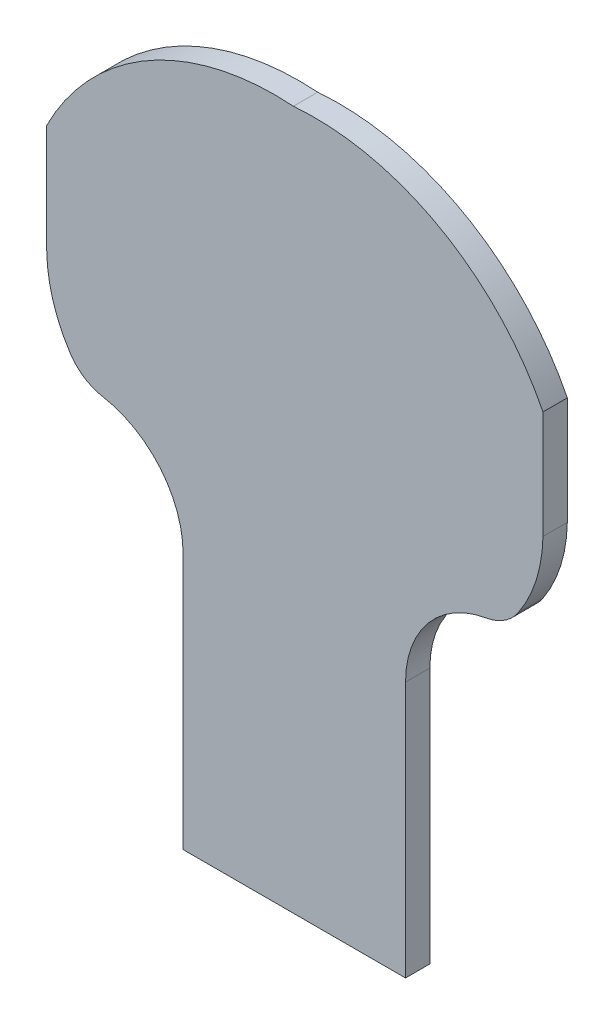
from build123d import *

# Parameters (mm, degrees)
EXTRUDE_1_DEPTH = 5


with BuildPart() as part:
    # Эскиз1 → Вытянуть1 (new body)
    with BuildSketch(Plane.XY):
        with BuildLine():
            Line((51.051218407, 63.479620652), (51.051218407, 85.650578303))
            ThreePointArc((51.051218407, 85.650578303), (29.802220844, 107.884883479), (-0.253176534, 114.408480073))
            ThreePointArc((-0.253176534, 114.408480073), (-29.956404365, 107.707450913), (-50.948781593, 85.650578205))
            Line((-50.948781593, 85.650578205), (-50.948781593, 63.479620652))
            ThreePointArc((-50.948781593, 63.479620652), (-49.676003697, 55.151129839), (-46.113662299, 47.516115329))
            ThreePointArc((-46.113662299, 47.516115329), (-43.24429549, 44.636868096), (-39.466032041, 43.137516297))
            ThreePointArc((-39.466032041, 43.137516297), (-27.599168456, 36.303107276), (-22.910878505, 23.436424124))
            Line((-22.910878505, 23.436424124), (-22.910878505, -29.232372122))
            Line((-22.910878505, -29.232372122), (22.801652741, -29.232372122))
            Line((22.801652741, -29.232372122), (22.801652741, 23.436424124))
            ThreePointArc((22.801652741, 23.436424124), (27.504627406, 36.320562274), (39.401754329, 43.145322895))
            ThreePointArc((39.401754329, 43.145322895), (43.142841115, 44.60959187), (46.005754814, 47.428020354))
            ThreePointArc((46.005754814, 47.428020354), (49.685829012, 55.090035656), (51.051218407, 63.479620652))
        make_face()
    extrude(amount=EXTRUDE_1_DEPTH)


solid = part.part
